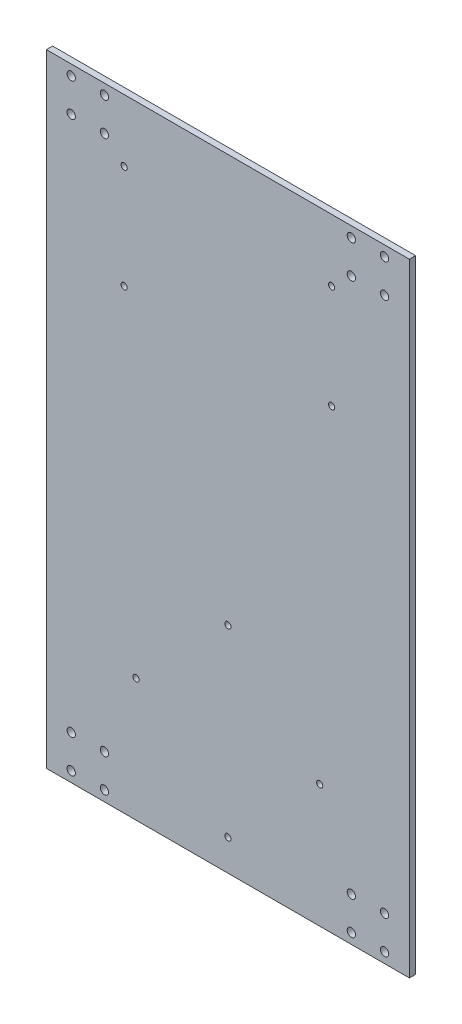
from build123d import *

# Parameters (mm, degrees)
SKETCH_1_W          = 175
SKETCH_1_H          = 300
EXTRUDE_1_DEPTH     = 3
SKETCH_2_R          = 1.5
CUT_EXTRUDE_1_DEPTH = 3
SKETCH_3_R          = 1.5
CUT_EXTRUDE_2_DEPTH = 3
SKETCH_4_R          = 2
CUT_EXTRUDE_3_DEPTH = 10


with BuildPart() as part:
    # 草图1 → 凸台-拉伸1 (new body)
    with BuildSketch(Plane.XY):
        Rectangle(SKETCH_1_W, SKETCH_1_H)
    extrude(amount=EXTRUDE_1_DEPTH)

    # 草图2 → 切除-拉伸1 (cut)
    with BuildSketch(Plane.XY.offset(3)):
        with Locations((0, -135)):
            Circle(SKETCH_2_R)
        with Locations((-44.25, -90.75)):
            Circle(SKETCH_2_R)
        with Locations((0, -46.5)):
            Circle(SKETCH_2_R)
        with Locations((44.25, -90.75)):
            Circle(SKETCH_2_R)
    extrude(amount=-CUT_EXTRUDE_1_DEPTH, mode=Mode.SUBTRACT)

    # 草图3 → 切除-拉伸2 (cut)
    with BuildSketch(Plane.XY.offset(3)):
        with Locations((50, 70)):
            Circle(SKETCH_3_R)
        with Locations((50, 120)):
            Circle(SKETCH_3_R)
        with Locations((-50, 120)):
            Circle(SKETCH_3_R)
        with Locations((-50, 70)):
            Circle(SKETCH_3_R)
    extrude(amount=-CUT_EXTRUDE_2_DEPTH, mode=Mode.SUBTRACT)

    # 草图4 → 切除-拉伸3 (cut)
    with BuildSketch(Plane.XY.offset(3)):
        with Locations((-75.5, 145)):
            Circle(SKETCH_4_R)
        with Locations((-59.5, 145)):
            Circle(SKETCH_4_R)
        with Locations((-59.5, 129)):
            Circle(SKETCH_4_R)
        with Locations((-75.5, 129)):
            Circle(SKETCH_4_R)
        with Locations((-59.5, -145)):
            Circle(SKETCH_4_R)
        with Locations((-75.5, -145)):
            Circle(SKETCH_4_R)
        with Locations((-59.5, -129)):
            Circle(SKETCH_4_R)
        with Locations((-75.5, -129)):
            Circle(SKETCH_4_R)
        with Locations((75.5, -145)):
            Circle(SKETCH_4_R)
        with Locations((75.5, -129)):
            Circle(SKETCH_4_R)
        with Locations((59.5, -129)):
            Circle(SKETCH_4_R)
        with Locations((59.5, -145)):
            Circle(SKETCH_4_R)
        with Locations((75.5, 129)):
            Circle(SKETCH_4_R)
        with Locations((59.5, 145)):
            Circle(SKETCH_4_R)
        with Locations((75.5, 145)):
            Circle(SKETCH_4_R)
        with Locations((59.5, 129)):
            Circle(SKETCH_4_R)
    extrude(amount=-CUT_EXTRUDE_3_DEPTH, mode=Mode.SUBTRACT)


solid = part.part
